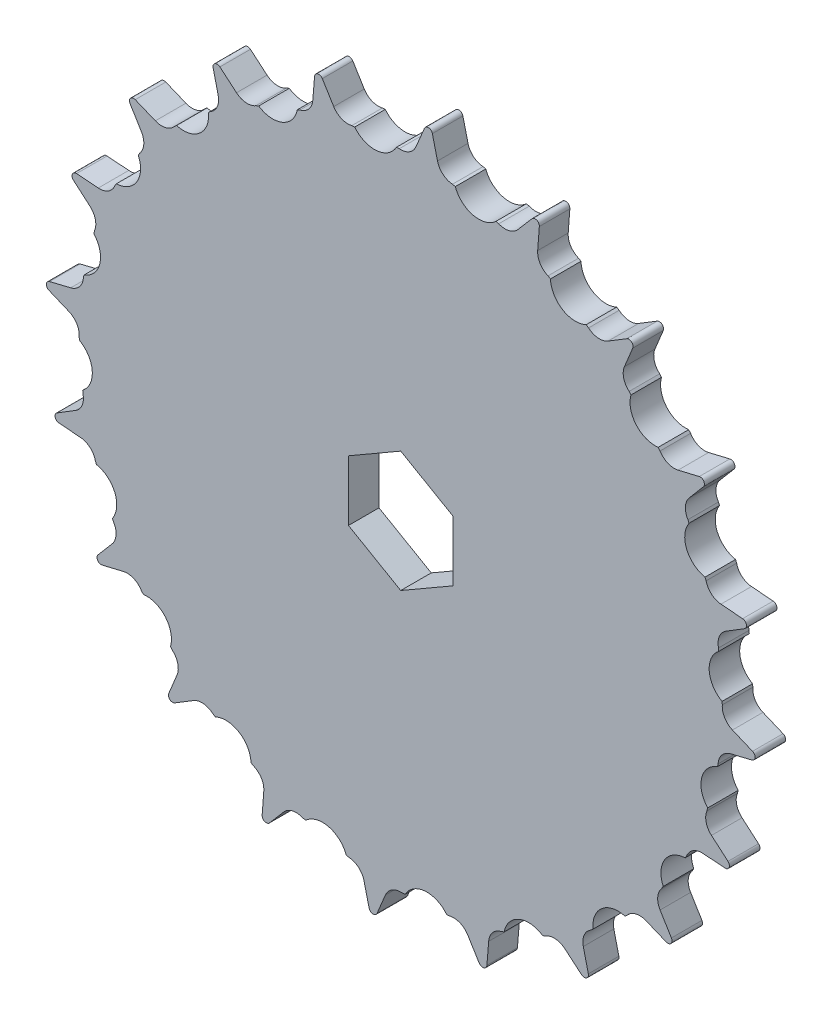
from build123d import *

# Parameters (mm, degrees)
BOSS_EXTRUDE1_DEPTH                 = 7.3
SKETCH2_R                           = 12.5
BOSS_EXTRUDE2_DEPTH                 = 40
FILLET1_R                           = 30
SKETCH3_R                           = 5
CUT_EXTRUDE1_DEPTH                  = 129.838593424
F_1_0MM_DOWEL_HOLE1_D               = 2.8
F_1_0MM_DOWEL_HOLE1_DEPTH           = 33.158795133
F_1_0MM_DOWEL_HOLE1_TIP             = 0.841204867
F_1_0MM_DOWEL_HOLE1_ON_FACE_2_D     = 2.8
F_1_0MM_DOWEL_HOLE1_ON_FACE_2_DEPTH = 33.158795133
F_1_0MM_DOWEL_HOLE1_ON_FACE_2_TIP   = 0.841204867
CUT_EXTRUDE2_DEPTH                  = 10
CIRPATTERN1_COUNT                   = 20
CUT_EXTRUDE3_DEPTH                  = 129.83859346
CUT_EXTRUDE4_DEPTH                  = 126.5124821
CUT_EXTRUDE4_DEPTH_BACK             = 126.5124821
SKETCH8_W                           = 174.571261172
SKETCH8_H                           = 35.416241256


with BuildPart() as part:
    # Sketch1 → Boss-Extrude1 (new body)
    with BuildSketch(Plane.XY):
        with BuildLine():
            ThreePointArc((3.662609618, 79.321514688), (0, 76.88125), (-3.662609618, 79.321514688))
            Line((-3.662609618, 79.321514688), (-5.667701775, 84.126186191))
            ThreePointArc((-5.667701775, 84.126186191), (-6.669023137, 84.737973367), (-7.562311971, 83.977077135))
            Line((-7.562311971, 83.977077135), (-8.791101901, 78.917893592))
            ThreePointArc((-8.791101901, 78.917893592), (-12.026877215, 75.934714235), (-16.026135532, 77.77197684))
            Line((-16.026135532, 77.77197684), (-18.758157894, 82.203829344))
            ThreePointArc((-18.758157894, 82.203829344), (-19.842855928, 82.651443234), (-20.606116499, 81.760173735))
            Line((-20.606116499, 81.760173735), (-21.028347314, 76.571052042))
            ThreePointArc((-21.028347314, 76.571052042), (-23.757612799, 73.118413793), (-27.995044802, 74.307434811))
            Line((-27.995044802, 74.307434811), (-31.386725911, 78.2573414))
            ThreePointArc((-31.386725911, 78.2573414), (-32.528091751, 78.529760263), (-33.142530051, 77.530063512))
            Line((-33.142530051, 77.530063512), (-32.747805028, 72.338777067))
            ThreePointArc((-32.747805028, 72.338777067), (-34.903357108, 68.501695338), (-39.274623159, 69.013197125))
            Line((-39.274623159, 69.013197125), (-43.242448569, 72.38389799))
            ThreePointArc((-43.242448569, 72.38389799), (-44.412378001, 72.47441397), (-44.862864519, 71.390905818))
            Line((-44.862864519, 71.390905818), (-43.660903098, 66.325281321))
            ThreePointArc((-43.660903098, 66.325281321), (-45.189664928, 62.198237799), (-49.587129948, 62.019625484))
            Line((-49.587129948, 62.019625484), (-54.03339863, 64.728122783))
            ThreePointArc((-54.03339863, 64.728122783), (-55.203084108, 64.634507076), (-55.478526372, 63.49386709))
            Line((-55.478526372, 63.49386709), (-53.498924832, 58.678637028))
            ThreePointArc((-53.498924832, 58.678637028), (-54.363253221, 54.363253221), (-58.678637028, 53.498924832))
            Line((-58.678637028, 53.498924832), (-63.49386709, 55.478526372))
            ThreePointArc((-63.49386709, 55.478526372), (-64.634507076, 55.203084108), (-64.728122783, 54.03339863))
            Line((-64.728122783, 54.03339863), (-62.019625484, 49.587129948))
            ThreePointArc((-62.019625484, 49.587129948), (-62.198237799, 45.189664928), (-66.325281321, 43.660903098))
            Line((-66.325281321, 43.660903098), (-71.390905818, 44.862864519))
            ThreePointArc((-71.390905818, 44.862864519), (-72.47441397, 44.412378001), (-72.38389799, 43.242448569))
            Line((-72.38389799, 43.242448569), (-69.013197125, 39.274623159))
            ThreePointArc((-69.013197125, 39.274623159), (-68.501695338, 34.903357108), (-72.338777067, 32.747805028))
            Line((-72.338777067, 32.747805028), (-77.530063512, 33.142530051))
            ThreePointArc((-77.530063512, 33.142530051), (-78.529760263, 32.528091751), (-78.2573414, 31.386725911))
            Line((-78.2573414, 31.386725911), (-74.307434811, 27.995044802))
            ThreePointArc((-74.307434811, 27.995044802), (-73.118413793, 23.757612799), (-76.571052042, 21.028347314))
            Line((-76.571052042, 21.028347314), (-81.760173735, 20.606116499))
            ThreePointArc((-81.760173735, 20.606116499), (-82.651443234, 19.842855928), (-82.203829344, 18.758157894))
            Line((-82.203829344, 18.758157894), (-77.77197684, 16.026135532))
            ThreePointArc((-77.77197684, 16.026135532), (-75.934714235, 12.026877215), (-78.917893592, 8.791101901))
            Line((-78.917893592, 8.791101901), (-83.977077135, 7.562311971))
            ThreePointArc((-83.977077135, 7.562311971), (-84.737973367, 6.669023137), (-84.126186191, 5.667701775))
            Line((-84.126186191, 5.667701775), (-79.321514688, 3.662609618))
            ThreePointArc((-79.321514688, 3.662609618), (-76.88125, 0), (-79.321514688, -3.662609618))
            Line((-79.321514688, -3.662609618), (-84.126186191, -5.667701775))
            ThreePointArc((-84.126186191, -5.667701775), (-84.737973367, -6.669023137), (-83.977077135, -7.562311971))
            Line((-83.977077135, -7.562311971), (-78.917893592, -8.791101901))
            ThreePointArc((-78.917893592, -8.791101901), (-75.934714235, -12.026877215), (-77.77197684, -16.026135532))
            Line((-77.77197684, -16.026135532), (-82.203829344, -18.758157894))
            ThreePointArc((-82.203829344, -18.758157894), (-82.651443234, -19.842855928), (-81.760173735, -20.606116499))
            Line((-81.760173735, -20.606116499), (-76.571052042, -21.028347314))
            ThreePointArc((-76.571052042, -21.028347314), (-73.118413793, -23.757612799), (-74.307434811, -27.995044802))
            Line((-74.307434811, -27.995044802), (-78.2573414, -31.386725911))
            ThreePointArc((-78.2573414, -31.386725911), (-78.529760263, -32.528091751), (-77.530063512, -33.142530051))
            Line((-77.530063512, -33.142530051), (-72.338777067, -32.747805028))
            ThreePointArc((-72.338777067, -32.747805028), (-68.501695338, -34.903357108), (-69.013197125, -39.274623159))
            Line((-69.013197125, -39.274623159), (-72.38389799, -43.242448569))
            ThreePointArc((-72.38389799, -43.242448569), (-72.47441397, -44.412378001), (-71.390905818, -44.862864519))
            Line((-71.390905818, -44.862864519), (-66.325281321, -43.660903098))
            ThreePointArc((-66.325281321, -43.660903098), (-62.198237799, -45.189664928), (-62.019625484, -49.587129948))
            Line((-62.019625484, -49.587129948), (-64.728122783, -54.03339863))
            ThreePointArc((-64.728122783, -54.03339863), (-64.634507076, -55.203084108), (-63.49386709, -55.478526372))
            Line((-63.49386709, -55.478526372), (-58.678637028, -53.498924832))
            ThreePointArc((-58.678637028, -53.498924832), (-54.363253221, -54.363253221), (-53.498924832, -58.678637028))
            Line((-53.498924832, -58.678637028), (-55.478526372, -63.49386709))
            ThreePointArc((-55.478526372, -63.49386709), (-55.203084108, -64.634507076), (-54.03339863, -64.728122783))
            Line((-54.03339863, -64.728122783), (-49.587129948, -62.019625484))
            ThreePointArc((-49.587129948, -62.019625484), (-45.189664928, -62.198237799), (-43.660903098, -66.325281321))
            Line((-43.660903098, -66.325281321), (-44.862864519, -71.390905818))
            ThreePointArc((-44.862864519, -71.390905818), (-44.412378001, -72.47441397), (-43.242448569, -72.38389799))
            Line((-43.242448569, -72.38389799), (-39.274623159, -69.013197125))
            ThreePointArc((-39.274623159, -69.013197125), (-34.903357108, -68.501695338), (-32.747805028, -72.338777067))
            Line((-32.747805028, -72.338777067), (-33.142530051, -77.530063512))
            ThreePointArc((-33.142530051, -77.530063512), (-32.528091751, -78.529760263), (-31.386725911, -78.2573414))
            Line((-31.386725911, -78.2573414), (-27.995044802, -74.307434811))
            ThreePointArc((-27.995044802, -74.307434811), (-23.757612799, -73.118413793), (-21.028347314, -76.571052042))
            Line((-21.028347314, -76.571052042), (-20.606116499, -81.760173735))
            ThreePointArc((-20.606116499, -81.760173735), (-19.842855928, -82.651443234), (-18.758157894, -82.203829344))
            Line((-18.758157894, -82.203829344), (-16.026135532, -77.77197684))
            ThreePointArc((-16.026135532, -77.77197684), (-12.026877215, -75.934714235), (-8.791101901, -78.917893592))
            Line((-8.791101901, -78.917893592), (-7.562311971, -83.977077135))
            ThreePointArc((-7.562311971, -83.977077135), (-6.669023137, -84.737973367), (-5.667701775, -84.126186191))
            Line((-5.667701775, -84.126186191), (-3.662609618, -79.321514688))
            ThreePointArc((-3.662609618, -79.321514688), (0, -76.88125), (3.662609618, -79.321514688))
            Line((3.662609618, -79.321514688), (5.667701775, -84.126186191))
            ThreePointArc((5.667701775, -84.126186191), (6.669023137, -84.737973367), (7.562311971, -83.977077135))
            Line((7.562311971, -83.977077135), (8.791101901, -78.917893592))
            ThreePointArc((8.791101901, -78.917893592), (12.026877215, -75.934714235), (16.026135532, -77.77197684))
            Line((16.026135532, -77.77197684), (18.758157894, -82.203829344))
            ThreePointArc((18.758157894, -82.203829344), (19.842855928, -82.651443234), (20.606116499, -81.760173735))
            Line((20.606116499, -81.760173735), (21.028347314, -76.571052042))
            ThreePointArc((21.028347314, -76.571052042), (23.757612799, -73.118413793), (27.995044802, -74.307434811))
            Line((27.995044802, -74.307434811), (31.386725911, -78.2573414))
            ThreePointArc((31.386725911, -78.2573414), (32.528091751, -78.529760263), (33.142530051, -77.530063512))
            Line((33.142530051, -77.530063512), (32.747805028, -72.338777067))
            ThreePointArc((32.747805028, -72.338777067), (34.903357108, -68.501695338), (39.274623159, -69.013197125))
            Line((39.274623159, -69.013197125), (43.242448569, -72.38389799))
            ThreePointArc((43.242448569, -72.38389799), (44.412378001, -72.47441397), (44.862864519, -71.390905818))
            Line((44.862864519, -71.390905818), (43.660903098, -66.325281321))
            ThreePointArc((43.660903098, -66.325281321), (45.189664928, -62.198237799), (49.587129948, -62.019625484))
            Line((49.587129948, -62.019625484), (54.03339863, -64.728122783))
            ThreePointArc((54.03339863, -64.728122783), (55.203084108, -64.634507076), (55.478526372, -63.49386709))
            Line((55.478526372, -63.49386709), (53.498924832, -58.678637028))
            ThreePointArc((53.498924832, -58.678637028), (54.363253221, -54.363253221), (58.678637028, -53.498924832))
            Line((58.678637028, -53.498924832), (63.49386709, -55.478526372))
            ThreePointArc((63.49386709, -55.478526372), (64.634507076, -55.203084108), (64.728122783, -54.03339863))
            Line((64.728122783, -54.03339863), (62.019625484, -49.587129948))
            ThreePointArc((62.019625484, -49.587129948), (62.198237799, -45.189664928), (66.325281321, -43.660903098))
            Line((66.325281321, -43.660903098), (71.390905818, -44.862864519))
            ThreePointArc((71.390905818, -44.862864519), (72.47441397, -44.412378001), (72.38389799, -43.242448569))
            Line((72.38389799, -43.242448569), (69.013197125, -39.274623159))
            ThreePointArc((69.013197125, -39.274623159), (68.501695338, -34.903357108), (72.338777067, -32.747805028))
            Line((72.338777067, -32.747805028), (77.530063512, -33.142530051))
            ThreePointArc((77.530063512, -33.142530051), (78.529760263, -32.528091751), (78.2573414, -31.386725911))
            Line((78.2573414, -31.386725911), (74.307434811, -27.995044802))
            ThreePointArc((74.307434811, -27.995044802), (73.118413793, -23.757612799), (76.571052042, -21.028347314))
            Line((76.571052042, -21.028347314), (81.760173735, -20.606116499))
            ThreePointArc((81.760173735, -20.606116499), (82.651443234, -19.842855928), (82.203829344, -18.758157894))
            Line((82.203829344, -18.758157894), (77.77197684, -16.026135532))
            ThreePointArc((77.77197684, -16.026135532), (75.934714235, -12.026877215), (78.917893592, -8.791101901))
            Line((78.917893592, -8.791101901), (83.977077135, -7.562311971))
            ThreePointArc((83.977077135, -7.562311971), (84.737973367, -6.669023137), (84.126186191, -5.667701775))
            Line((84.126186191, -5.667701775), (79.321514688, -3.662609618))
            ThreePointArc((79.321514688, -3.662609618), (76.88125, 0), (79.321514688, 3.662609618))
            Line((79.321514688, 3.662609618), (84.126186191, 5.667701775))
            ThreePointArc((84.126186191, 5.667701775), (84.737973367, 6.669023137), (83.977077135, 7.562311971))
            Line((83.977077135, 7.562311971), (78.917893592, 8.791101901))
            ThreePointArc((78.917893592, 8.791101901), (75.934714235, 12.026877215), (77.77197684, 16.026135532))
            Line((77.77197684, 16.026135532), (82.203829344, 18.758157894))
            ThreePointArc((82.203829344, 18.758157894), (82.651443234, 19.842855928), (81.760173735, 20.606116499))
            Line((81.760173735, 20.606116499), (76.571052042, 21.028347314))
            ThreePointArc((76.571052042, 21.028347314), (73.118413793, 23.757612799), (74.307434811, 27.995044802))
            Line((74.307434811, 27.995044802), (78.2573414, 31.386725911))
            ThreePointArc((78.2573414, 31.386725911), (78.529760263, 32.528091751), (77.530063512, 33.142530051))
            Line((77.530063512, 33.142530051), (72.338777067, 32.747805028))
            ThreePointArc((72.338777067, 32.747805028), (68.501695338, 34.903357108), (69.013197125, 39.274623159))
            Line((69.013197125, 39.274623159), (72.38389799, 43.242448569))
            ThreePointArc((72.38389799, 43.242448569), (72.47441397, 44.412378001), (71.390905818, 44.862864519))
            Line((71.390905818, 44.862864519), (66.325281321, 43.660903098))
            ThreePointArc((66.325281321, 43.660903098), (62.198237799, 45.189664928), (62.019625484, 49.587129948))
            Line((62.019625484, 49.587129948), (64.728122783, 54.03339863))
            ThreePointArc((64.728122783, 54.03339863), (64.634507076, 55.203084108), (63.49386709, 55.478526372))
            Line((63.49386709, 55.478526372), (58.678637028, 53.498924832))
            ThreePointArc((58.678637028, 53.498924832), (54.363253221, 54.363253221), (53.498924832, 58.678637028))
            Line((53.498924832, 58.678637028), (55.478526372, 63.49386709))
            ThreePointArc((55.478526372, 63.49386709), (55.203084108, 64.634507076), (54.03339863, 64.728122783))
            Line((54.03339863, 64.728122783), (49.587129948, 62.019625484))
            ThreePointArc((49.587129948, 62.019625484), (45.189664928, 62.198237799), (43.660903098, 66.325281321))
            Line((43.660903098, 66.325281321), (44.862864519, 71.390905818))
            ThreePointArc((44.862864519, 71.390905818), (44.412378001, 72.47441397), (43.242448569, 72.38389799))
            Line((43.242448569, 72.38389799), (39.274623159, 69.013197125))
            ThreePointArc((39.274623159, 69.013197125), (34.903357108, 68.501695338), (32.747805028, 72.338777067))
            Line((32.747805028, 72.338777067), (33.142530051, 77.530063512))
            ThreePointArc((33.142530051, 77.530063512), (32.528091751, 78.529760263), (31.386725911, 78.2573414))
            Line((31.386725911, 78.2573414), (27.995044802, 74.307434811))
            ThreePointArc((27.995044802, 74.307434811), (23.757612799, 73.118413793), (21.028347314, 76.571052042))
            Line((21.028347314, 76.571052042), (20.606116499, 81.760173735))
            ThreePointArc((20.606116499, 81.760173735), (19.842855928, 82.651443234), (18.758157894, 82.203829344))
            Line((18.758157894, 82.203829344), (16.026135532, 77.77197684))
            ThreePointArc((16.026135532, 77.77197684), (12.026877215, 75.934714235), (8.791101901, 78.917893592))
            Line((8.791101901, 78.917893592), (7.562311971, 83.977077135))
            ThreePointArc((7.562311971, 83.977077135), (6.669023137, 84.737973367), (5.667701775, 84.126186191))
            Line((5.667701775, 84.126186191), (3.662609618, 79.321514688))
        make_face()
    extrude(amount=BOSS_EXTRUDE1_DEPTH)

    # Sketch2 → Boss-Extrude2 (add)
    with BuildSketch(Plane.XY.offset(7.3)):
        Circle(SKETCH2_R)
    extrude(amount=BOSS_EXTRUDE2_DEPTH)

    # Fillet1
    fillet1_edges = [part.edges().sort_by_distance(p)[0] for p in [
        (-12.5, 0, 7.3),
    ]]
    fillet(fillet1_edges, radius=FILLET1_R)

    # Sketch3 → Cut-Extrude1 (cut, through all)
    with BuildSketch(Plane.XY.offset(47.3)):
        Circle(SKETCH3_R)
    extrude(amount=-CUT_EXTRUDE1_DEPTH, mode=Mode.SUBTRACT)

    # Ø1.0mm Dowel Hole1
    with Locations(Plane(origin=(-6.81763654, -10.477109907, 42.020116055), x_dir=(-0.838168792578, 0.545410923202, 0), z_dir=(-0.545410923202, -0.838168792578, 0))):
        with Locations((0, 0)):
            Hole(F_1_0MM_DOWEL_HOLE1_D / 2, depth=F_1_0MM_DOWEL_HOLE1_DEPTH)
            with Locations((0, 0, -(F_1_0MM_DOWEL_HOLE1_DEPTH + F_1_0MM_DOWEL_HOLE1_TIP / 2))):  # 118° drill point
                Cone(0, F_1_0MM_DOWEL_HOLE1_D / 2, F_1_0MM_DOWEL_HOLE1_TIP, mode=Mode.SUBTRACT)

    # Ø1.0mm Dowel Hole1 on face 2
    with Locations(Plane(origin=(-11.068439798, 5.808583342, 41.658255729), x_dir=(-0.464687003812, -0.885475007264, 0), z_dir=(-0.885475007264, 0.464687003812, 0))):
        with Locations((0, 0)):
            Hole(F_1_0MM_DOWEL_HOLE1_ON_FACE_2_D / 2, depth=F_1_0MM_DOWEL_HOLE1_ON_FACE_2_DEPTH)
            with Locations((0, 0, -(F_1_0MM_DOWEL_HOLE1_ON_FACE_2_DEPTH + F_1_0MM_DOWEL_HOLE1_ON_FACE_2_TIP / 2))):  # 118° drill point
                Cone(0, F_1_0MM_DOWEL_HOLE1_ON_FACE_2_D / 2, F_1_0MM_DOWEL_HOLE1_ON_FACE_2_TIP, mode=Mode.SUBTRACT)

    # Sketch5 → Cut-Extrude2 (cut)
    with BuildSketch(Plane(origin=(0, 0, 0), x_dir=(-1, 0, 0), z_dir=(0, 0, -1))):
        with BuildLine():
            Line((-0.961651803, 76.999519203), (1.032182864, 76.842601011))
            ThreePointArc((1.032182864, 76.842601011), (5.80623434, 73.775202273), (11.001356201, 76.058010054))
            Line((11.001356201, 76.058010054), (12.995190869, 75.901091862))
            Line((12.995190869, 75.901091862), (13.647444473, 84.188759697))
            Line((13.647444473, 84.188759697), (-0.309398199, 85.287187037))
            Line((-0.309398199, 85.287187037), (-0.961651803, 76.999519203))
        make_face()
    cut_extrude2 = extrude(amount=-CUT_EXTRUDE2_DEPTH, mode=Mode.SUBTRACT)

    # CirPattern1: Cut-Extrude2 ×20 about axis
    cirpattern1_axis = Axis((0, 0, 0), (0, 0, 1))
    for i in range(1, CIRPATTERN1_COUNT):
        add(cut_extrude2.rotate(cirpattern1_axis, i * 360 / CIRPATTERN1_COUNT), mode=Mode.SUBTRACT)

    # Sketch7 → Cut-Extrude3 (cut, through all)
    with BuildSketch(Plane(origin=(0, 0, 0), x_dir=(-1, 0, 0), z_dir=(0, 0, -1))):
        Polygon((12.5, -7.216878365), (12.5, 7.216878365), (0, 14.43375673), (-12.5, 7.216878365), (-12.5, -7.216878365), (0, -14.43375673), align=None)
    extrude(amount=-CUT_EXTRUDE3_DEPTH, mode=Mode.SUBTRACT)

    # Sketch8 → Cut-Extrude4 (cut, two sides: drawn at the far end of the back side and taken through both)
    with BuildSketch(Plane(origin=(0, 0, 0), x_dir=(1, 0, 0), z_dir=(0, 1, 0)).offset(-CUT_EXTRUDE4_DEPTH_BACK)):
        with Locations((3.308553451, -25.008120628)):
            Rectangle(SKETCH8_W, SKETCH8_H)
    extrude(amount=CUT_EXTRUDE4_DEPTH + CUT_EXTRUDE4_DEPTH_BACK, mode=Mode.SUBTRACT)


solid = part.part
